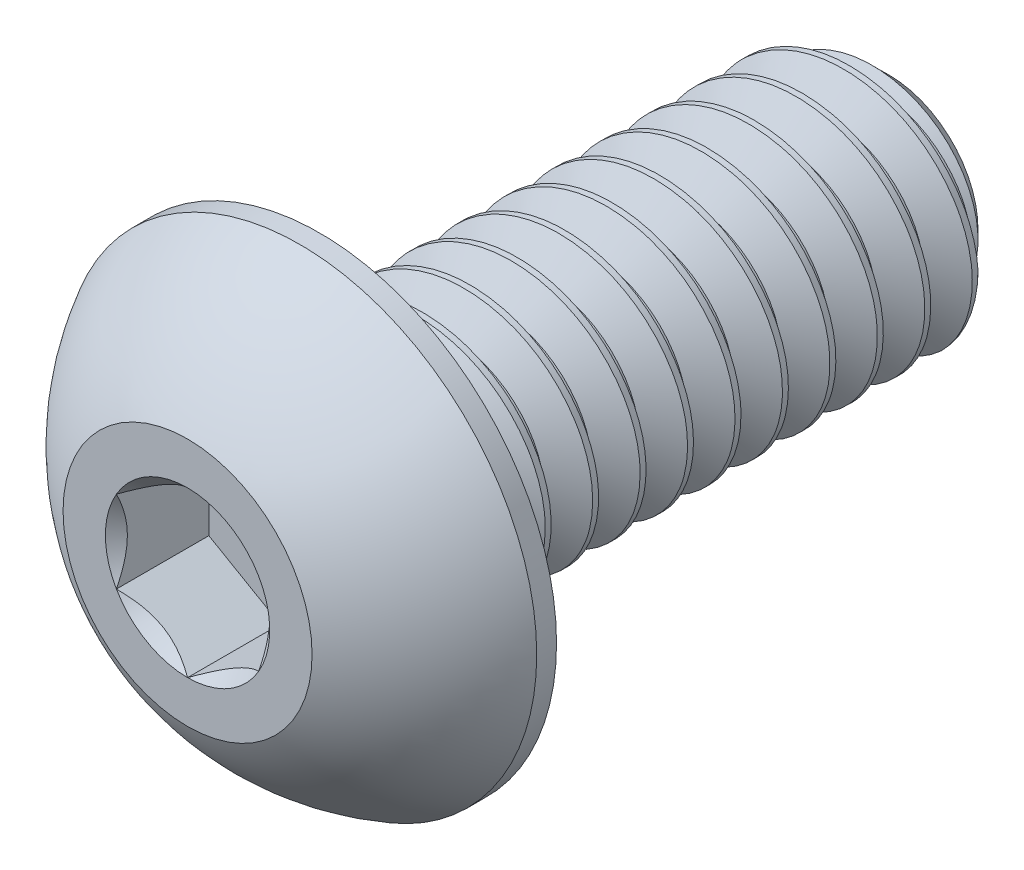
from build123d import *

# Parameters (mm, degrees)
SKETCH1_W          = 9.525
SKETCH1_H          = 2.0828
CHAMFER1_SIZE      = 0.5953125
CUT_SWEEP1_PITCH   = 0.79375
CUT_EXTRUDE2_DEPTH = 1.54686


with BuildPart() as part:
    # Sketch1 → Revolve1 (revolve)
    with BuildSketch(Plane(origin=(0, 0, 0), x_dir=(0, 0, -1), z_dir=(1, 0, 0))):
        with Locations((6.9723, 1.0414)):
            Rectangle(SKETCH1_W, SKETCH1_H)
    revolve(axis=Axis((0, 0, -11.7348), (0, 0, 1)))

    # Chamfer1
    chamfer1_edges = [part.edges().sort_by_distance(p)[0] for p in [
        (0, -2.0828, -11.7348),
    ]]
    chamfer(chamfer1_edges, length=CHAMFER1_SIZE)

    # Cut-Sweep1: the profile of Sketch2 profile screwed along a right-hand helix of 13 turns, 8 arcs to a turn; built about Z, then put on its axis
    cut_sweep1_z = Axis((0, 0, 0), (0, 0, 1))
    cut_sweep1_corners = [(2.0831, 0, 0.000173205), (2.0831, 0, -0.694704455), (1.567244252, 0, -0.396875), (1.567244252, 0, -0.29765625)]
    with BuildLine(mode=Mode.PRIVATE) as cut_sweep1_profile:
        Line(cut_sweep1_corners[0], cut_sweep1_corners[1])
        Line(cut_sweep1_corners[1], cut_sweep1_corners[2])
        Line(cut_sweep1_corners[2], cut_sweep1_corners[3])
        Line(cut_sweep1_corners[3], cut_sweep1_corners[0])
    cut_sweep1_cap = Face(cut_sweep1_profile.wire())
    cut_sweep1_turn_angles = [0, 22.5, 45, 67.5, 90, 112.5, 135, 157.5, 180, 202.5, 225, 247.5, 270, 292.5, 315, 337.5, 360]
    cut_sweep1_turn_weights = [1, 0.9238795325112867, 1, 0.9238795325112867, 1, 0.9238795325112867, 1, 0.9238795325112867, 1, 0.9238795325112867, 1, 0.9238795325112867, 1, 0.9238795325112867, 1, 0.9238795325112867, 1]
    cut_sweep1_turn_rails = [Edge.make_bspline([Vector(p[0], p[1], 0).rotate(cut_sweep1_z, cut_sweep1_turn_angles[k]) / cut_sweep1_turn_weights[k] + Vector(0, 0, p[2] + CUT_SWEEP1_PITCH * cut_sweep1_turn_angles[k] / 360) for k in range(17)], [0, 0, 0, 1, 1, 2, 2, 3, 3, 4, 4, 5, 5, 6, 6, 7, 7, 8, 8, 8], 2, cut_sweep1_turn_weights) for p in cut_sweep1_corners]
    cut_sweep1_turn_sides = [Face.make_surface_from_curves(cut_sweep1_turn_rails[p[0]], cut_sweep1_turn_rails[p[1]]) for p in [(0, 1), (1, 2), (2, 3), (3, 0)]]
    cut_sweep1 = Plane(origin=(0, 0, -11.7348), x_dir=(0, 1, 0), z_dir=(0, 0, 1)) * Solid(Shell([*[p.moved(Location((0, 0, CUT_SWEEP1_PITCH * i))) for i in range(13) for p in cut_sweep1_turn_sides], cut_sweep1_cap, cut_sweep1_cap.rotate(cut_sweep1_z, 4680).moved(Location((0, 0, CUT_SWEEP1_PITCH * 4680 / 360)))]))
    add(cut_sweep1, mode=Mode.SUBTRACT)

    # Sketch7 → Revolve2 (revolve)
    with BuildSketch(Plane(origin=(0, 0, 0), x_dir=(0, 0, -1), z_dir=(1, 0, 0)), mode=Mode.PRIVATE) as revolve2_sk:
        with BuildLine():
            Line((1.87833, 3.9624), (2.2098, 3.9624))
            Line((2.2098, 3.9624), (2.2098, 0))
            Line((2.2098, 0), (0, 0))
            Line((0, 0), (0, 2.0828))
            ThreePointArc((0, 2.0828), (0.796523813, 3.165144808), (1.87833, 3.9624))
        make_face()
    revolve(revolve2_sk.sketch.rotate(Axis((0, 0, 0), (0, 0, -1)), 189.052465709), axis=Axis((0, 0, 0), (0, 0, -1)))

    # Sketch5 → Cut-Extrude2 (cut)
    with BuildSketch(Plane.XY):
        Polygon((1.190625, -0.687407664), (1.190625, 0.687407664), (0, 1.374815329), (-1.190625, 0.687407664), (-1.190625, -0.687407664), (0, -1.374815329), align=None)
    extrude(amount=-CUT_EXTRUDE2_DEPTH, mode=Mode.SUBTRACT)

    # Cut-Extrude3 cone 1 section (through the dimple's axis) → Cut-Extrude3 (revolve, cut)
    with BuildSketch(Plane(origin=(0, 0, 0), x_dir=(0, -1, 0), z_dir=(1, 0, 0))):
        Polygon((0, 0), (1.374815329, 0), (0, 1.374815329), align=None)
    revolve(axis=Axis((0, 0, 0), (0, 0, -1)), mode=Mode.SUBTRACT)


solid = part.part
